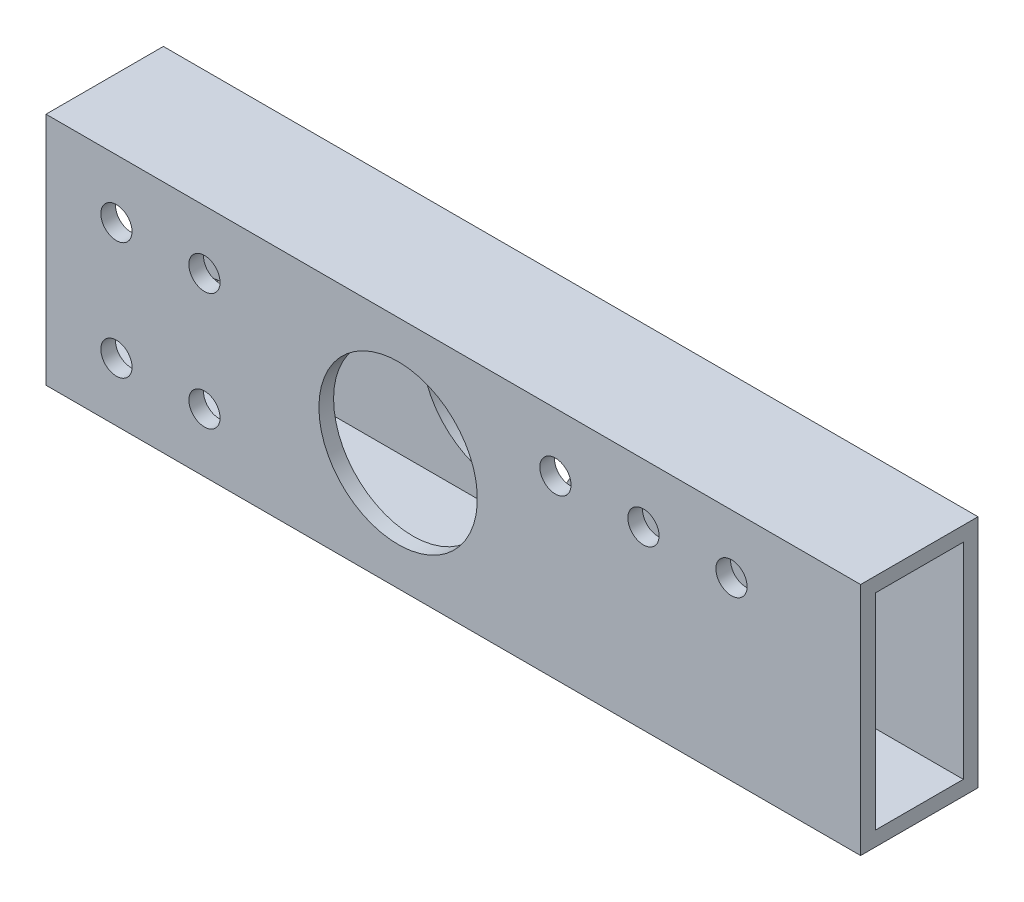
from build123d import *

# Parameters (mm, degrees)
SKETCH1_W           = 176.276
SKETCH1_H           = 25.4
BOSS_EXTRUDE1_DEPTH = 50.8
SKETCH2_OUTSIDE_W   = 64.44
SKETCH2_OUTSIDE_H   = 89.84
SKETCH2_OUTSIDE_W_2 = 25.4
SKETCH2_OUTSIDE_H_2 = 50.8
SKETCH2_OUTSIDE_W_3 = 19.05
SKETCH2_OUTSIDE_H_3 = 44.45
CUT_EXTRUDE1_DEPTH  = 186.199968078
SKETCH3_R           = 17.145
CUT_EXTRUDE2_DEPTH  = 186.199968078
SKETCH4_R           = 3.3782
CUT_EXTRUDE3_DEPTH  = 186.199968078
SKETCH5_R           = 3.3782
CUT_EXTRUDE4_DEPTH  = 186.199968078


with BuildPart() as part:
    # Sketch1 → Boss-Extrude1 (new body)
    with BuildSketch(Plane(origin=(0, 0, 0), x_dir=(1, 0, 0), z_dir=(0, 1, 0))):
        with Locations((88.138, 12.7)):
            Rectangle(SKETCH1_W, SKETCH1_H)
    extrude(amount=BOSS_EXTRUDE1_DEPTH)

    # Sketch2 outside → Cut-Extrude1 (cut, through all)
    # profile 1 of 2: a face of its own
    with BuildSketch(Plane(origin=(176.276, 0, 0), x_dir=(0, 0, -1), z_dir=(1, 0, 0))):
        with Locations((12.7, 25.4)):
            Rectangle(SKETCH2_OUTSIDE_W, SKETCH2_OUTSIDE_H)
        with Locations((12.7, 25.4)):
            Rectangle(SKETCH2_OUTSIDE_W_2, SKETCH2_OUTSIDE_H_2, mode=Mode.SUBTRACT)
    # profile 2 of 2: a face of its own
    with BuildSketch(Plane(origin=(176.276, 0, 0), x_dir=(0, 0, -1), z_dir=(1, 0, 0))):
        with Locations((12.7, 25.4)):
            Rectangle(SKETCH2_OUTSIDE_W_3, SKETCH2_OUTSIDE_H_3)
    extrude(amount=-CUT_EXTRUDE1_DEPTH, mode=Mode.SUBTRACT)

    # Sketch3 → Cut-Extrude2 (cut, through all)
    with BuildSketch(Plane(origin=(0, 0, -25.4), x_dir=(-1, 0, 0), z_dir=(0, 0, -1))):
        with Locations((-76.2, 25.4)):
            Circle(SKETCH3_R)
    extrude(amount=-CUT_EXTRUDE2_DEPTH, mode=Mode.SUBTRACT)

    # Sketch4 → Cut-Extrude3 (cut, through all)
    with BuildSketch(Plane.XY):
        with Locations((148.336, 38.1)):
            Circle(SKETCH4_R)
        with Locations((129.286, 38.1)):
            Circle(SKETCH4_R)
        with Locations((110.236, 38.1)):
            Circle(SKETCH4_R)
    extrude(amount=-CUT_EXTRUDE3_DEPTH, mode=Mode.SUBTRACT)

    # Sketch5 → Cut-Extrude4 (cut, through all)
    with BuildSketch(Plane.XY):
        with Locations((15.24, 38.1)):
            Circle(SKETCH5_R)
        with Locations((15.24, 12.7)):
            Circle(SKETCH5_R)
        with Locations((34.29, 12.7)):
            Circle(SKETCH5_R)
        with Locations((34.29, 38.1)):
            Circle(SKETCH5_R)
    extrude(amount=-CUT_EXTRUDE4_DEPTH, mode=Mode.SUBTRACT)


solid = part.part
